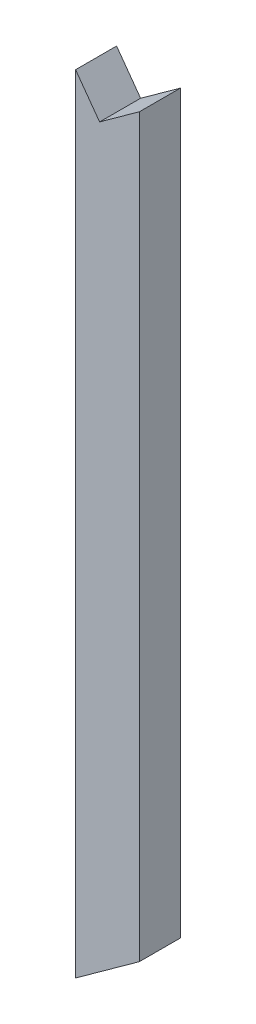
from build123d import *

# Parameters (mm, degrees)
SKETCH1_W                = 70
SKETCH1_H                = 45
SHAPE_DEPTH              = 1000
FRONT_DIAGONAL_CUT_REACH = 1003.624


with BuildPart() as part:
    # Sketch1 → Shape (new body)
    with BuildSketch(Plane(origin=(0, 0, 0), x_dir=(1, 0, 0), z_dir=(0, 1, 0))):
        Rectangle(SKETCH1_W, SKETCH1_H)
    extrude(amount=SHAPE_DEPTH)

    # Sketch3 → Front diagonal cut (cut, up to next)
    with BuildSketch(Plane.XY.offset(22.5), mode=Mode.PRIVATE) as front_diagonal_cut_sk1:
        Polygon((-8.671963655, 826.653999266), (35, 858.160201617), (35, 1000), (-35, 1000), (-35, 863.148307071), align=None)
    front_diagonal_cut_tool1 = extrude(front_diagonal_cut_sk1.sketch, amount=-FRONT_DIAGONAL_CUT_REACH, mode=Mode.PRIVATE) & part.part
    # Sketch3 → Front diagonal cut (cut, up to next)
    with BuildSketch(Plane.XY.offset(22.5), mode=Mode.PRIVATE) as front_diagonal_cut_sk2:
        Polygon((35, 0), (35, 50.5), (-35, 0), align=None)
    front_diagonal_cut_tool2 = extrude(front_diagonal_cut_sk2.sketch, amount=-FRONT_DIAGONAL_CUT_REACH, mode=Mode.PRIVATE) & part.part
    add(front_diagonal_cut_tool1.solids().sort_by_distance((-0.133653, 921.369964, 22.5))[0], mode=Mode.SUBTRACT)
    add(front_diagonal_cut_tool2.solids().sort_by_distance((11.666667, 16.833333, 22.5))[0], mode=Mode.SUBTRACT)


solid = part.part
